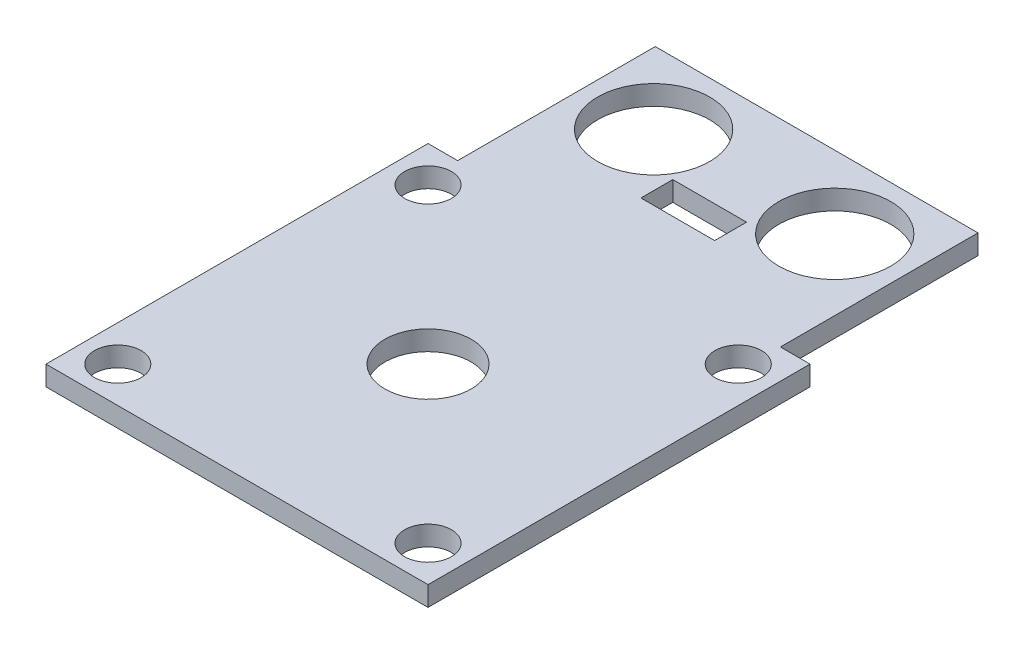
from build123d import *

# Parameters (mm, degrees)
SKETCH1_R           = 21
SKETCH1_R_2         = 20
BOSS_EXTRUDE1_DEPTH = 3.5
SKETCH2_R           = 3.55
SKETCH2_R_2         = 6.55
SKETCH2_R_3         = 8.5
SKETCH2_W           = 11.2
SKETCH2_H           = 4.84
BOSS_EXTRUDE2_DEPTH = 3
SKETCH3_W           = 11.2
SKETCH3_H           = 4.84
SKETCH3_W_2         = 49
SKETCH3_H_2         = 8
SKETCH3_R           = 8.5
IGNORE_DEPTH        = 3
SKETCH4_W           = 11.2
SKETCH4_H           = 4.84
SKETCH4_R           = 8.5
CUT_EXTRUDE2_DEPTH  = 66.835021075


with BuildPart() as part:
    # Sketch1 → Boss-Extrude1 (new body)
    with BuildSketch(Plane(origin=(0, 0, 0), x_dir=(1, 0, 0), z_dir=(0, 1, 0))):
        Circle(SKETCH1_R)
        Circle(SKETCH1_R_2, mode=Mode.SUBTRACT)
    extrude(amount=BOSS_EXTRUDE1_DEPTH)

    # Sketch2 → Boss-Extrude2 (add)
    with BuildSketch(Plane(origin=(0, 3.5, 0), x_dir=(1, 0, 0), z_dir=(0, 1, 0))):
        Polygon((-29, 29), (-29, -29), (29, -29), (29, 29), (24.5, 29), (24.5, 51), (-24.5, 51), (-24.5, 29), align=None)
        with Locations((-23.55, -23.55)):
            Circle(SKETCH2_R, mode=Mode.SUBTRACT)
        with Locations((23.55, -23.55)):
            Circle(SKETCH2_R, mode=Mode.SUBTRACT)
        Circle(SKETCH2_R_2, mode=Mode.SUBTRACT)
        with Locations((-23.55, 23.55)):
            Circle(SKETCH2_R, mode=Mode.SUBTRACT)
        with Locations((23.55, 23.55)):
            Circle(SKETCH2_R, mode=Mode.SUBTRACT)
        with Locations((13.76, 39)):
            Circle(SKETCH2_R_3, mode=Mode.SUBTRACT)
        with Locations((-13.76, 39)):
            Circle(SKETCH2_R_3, mode=Mode.SUBTRACT)
        with Locations((0, 46.28)):
            Rectangle(SKETCH2_W, SKETCH2_H, mode=Mode.SUBTRACT)
    extrude(amount=BOSS_EXTRUDE2_DEPTH)

    # Sketch3 → Ignore (add)
    with BuildSketch(Plane(origin=(0, 3.5, 0), x_dir=(1, 0, 0), z_dir=(0, 1, 0))):
        with Locations((0, 46.28)):
            Rectangle(SKETCH3_W, SKETCH3_H)
        with Locations((0, 55)):
            Rectangle(SKETCH3_W_2, SKETCH3_H_2)
        with Locations((-13.76, 39)):
            Circle(SKETCH3_R)
        with Locations((13.76, 39)):
            Circle(SKETCH3_R)
    extrude(amount=IGNORE_DEPTH)

    # Sketch4 → Cut-Extrude2 (cut, through all)
    with BuildSketch(Plane(origin=(0, 3.5, 0), x_dir=(1, 0, 0), z_dir=(0, 1, 0))):
        with Locations((-0.079148889, 40.42)):
            Rectangle(SKETCH4_W, SKETCH4_H)
        with Locations((-13.75, 48)):
            Circle(SKETCH4_R)
        with Locations((13.75, 48)):
            Circle(SKETCH4_R)
    extrude(amount=CUT_EXTRUDE2_DEPTH, mode=Mode.SUBTRACT)


solid = part.part
